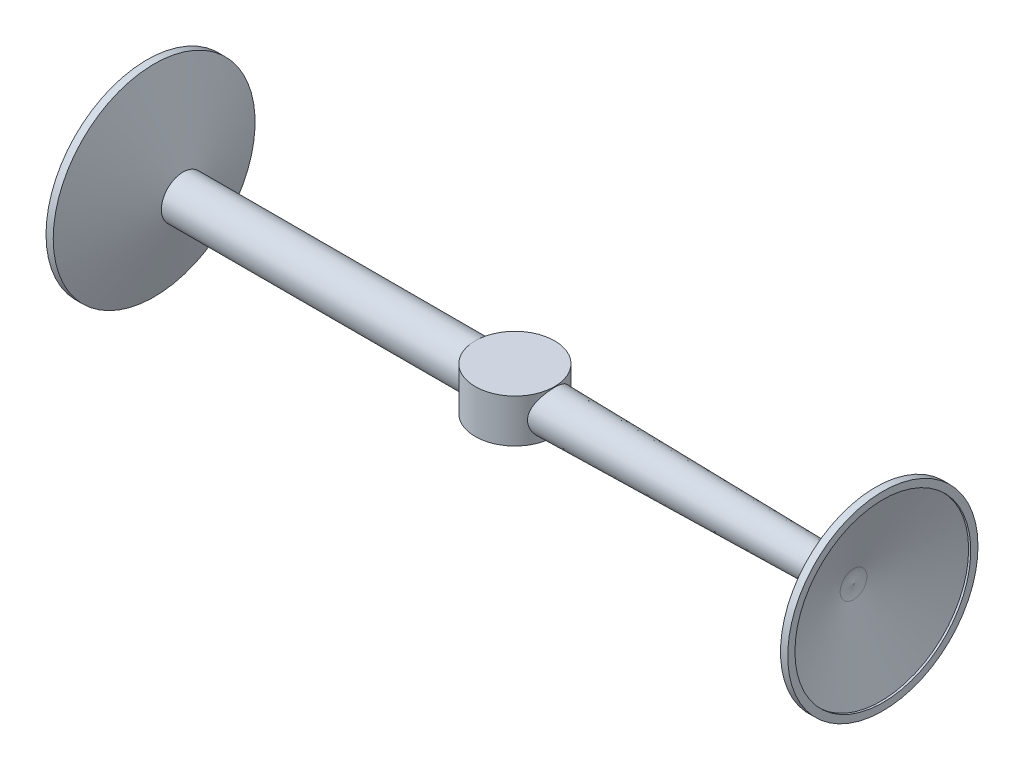
from build123d import *
from build123d.topology import SkipClean

# Parameters (mm, degrees)
SKETCH1_R                     = 27.5
BOSS_EXTRUDE1_DEPTH           = 30
SKETCH4_R                     = 15
BOSS_EXTRUDE3_DEPTH           = 230
BOSS_EXTRUDE3_TAPER           = 1
BOSS_EXTRUDE3_OTHER_WAY_DEPTH = 230
SKETCH2_R                     = 25
CUT_EXTRUDE4_DEPTH            = 20
SKETCH10_R                    = 65.934883456
BOSS_EXTRUDE7_DEPTH           = 5
SKETCH11_R                    = 69.949548389
BOSS_EXTRUDE8_DEPTH           = 5


# Read off the part's stored shape, not the designer's step: Boss-Extrude4, Boss-Extrude5
with BuildPart() as part:
    # Sketch1 → Boss-Extrude1 (new body)
    with BuildSketch(Plane(origin=(0, 0, 0), x_dir=(1, 0, 0), z_dir=(0, 1, 0))):
        with Locations(Location((0, 0, 0), (0, 0, 270))):
            Circle(SKETCH1_R)
    extrude(amount=BOSS_EXTRUDE1_DEPTH)

    # Sketch4 → Boss-Extrude3 (add)
    with BuildSketch(Plane(origin=(0, 0, 0), x_dir=(0, 0, -1), z_dir=(1, 0, 0))):
        with Locations((0, 15)):
            Circle(SKETCH4_R)
    extrude(amount=BOSS_EXTRUDE3_DEPTH, taper=BOSS_EXTRUDE3_TAPER)

    # Sketch4 → Boss-Extrude3 other way (add)
    with SkipClean():  # the faces are left unmerged after this step: merging them gives an invalid solid
        with BuildSketch(Plane(origin=(0, 0, 0), x_dir=(0, 0, -1), z_dir=(1, 0, 0))):
            with Locations((0, 15)):
                Circle(SKETCH4_R)
        extrude(amount=-BOSS_EXTRUDE3_OTHER_WAY_DEPTH)

    # Sketch2 → Cut-Extrude4 (cut)
    with SkipClean():  # the faces are left unmerged after this step: merging them gives an invalid solid
        with BuildSketch(Plane.XZ):
            with Locations(Location((0, 0, 0), (0, 0, 270))):
                Circle(SKETCH2_R)
        extrude(amount=-CUT_EXTRUDE4_DEPTH, mode=Mode.SUBTRACT)

    # Boss-Extrude4 outline → Boss-Extrude4 (revolve)
    with SkipClean():  # the faces are left unmerged after this step: merging them gives an invalid solid
        with BuildSketch(Plane(origin=(0, 15, 0), x_dir=(0, 1, 0), z_dir=(0, 0, -1))):
            Polygon((0, 230), (10.985335067, 230), (65.934883456, 250), (0, 250), align=None)
        revolve(axis=Axis((0, 15, 0), (1, 0, 0)))

    # Boss-Extrude5 outline → Boss-Extrude5 (revolve)
    with SkipClean():  # the faces are left unmerged after this step: merging them gives an invalid solid
        with BuildSketch(Plane(origin=(0, 15, 0), x_dir=(0, 1, 0), z_dir=(0, 0, -1))):
            Polygon((69.949548389, -250), (15, -230), (0, -230), (0, -250), align=None)
        revolve(axis=Axis((0, 15, 0), (1, 0, 0)))

    # Sketch10 → Boss-Extrude7 (add)
    with SkipClean():  # the faces are left unmerged after this step: merging them gives an invalid solid
        with BuildSketch(Plane(origin=(250, 0, 0), x_dir=(0, 0, -1), z_dir=(1, 0, 0))):
            with Locations((0, 15)):
                Circle(SKETCH10_R)
        extrude(amount=BOSS_EXTRUDE7_DEPTH)

    # Sketch11 → Boss-Extrude8 (add)
    with SkipClean():  # the faces are left unmerged after this step: merging them gives an invalid solid
        with BuildSketch(Plane.ZY.offset(250)):
            with Locations((0, 15)):
                Circle(SKETCH11_R)
        extrude(amount=BOSS_EXTRUDE8_DEPTH)

    # Sketch12 → Cut-Revolve3 (revolve, cut)
    with SkipClean():  # the faces are left unmerged after this step: merging them gives an invalid solid
        with BuildSketch(Plane(origin=(0, 15, 0), x_dir=(1, 0, 0), z_dir=(0, 1, 0)), mode=Mode.PRIVATE) as cut_revolve3_sk:
            with BuildLine():
                Line((-234.698463104, 13.289899283), (-253.501037691, 64.949548389))
                Line((-253.501037691, 64.949548389), (-255, 64.949548389))
                Line((-255, 64.949548389), (-255, 0))
                Line((-255, 0), (-234.698463104, 0))
                ThreePointArc((-234.698463104, 0), (-233.526779197, 6.644949642), (-234.698463104, 13.289899283))
            make_face()
        revolve(cut_revolve3_sk.sketch.rotate(Axis((373.268217057, 15, 0), (-1, 0, 0)), 270), axis=Axis((373.268217057, 15, 0), (-1, 0, 0)), mode=Mode.SUBTRACT)

    # Sketch14 → Cut-Revolve4 (revolve, cut)
    with SkipClean():  # the faces are left unmerged after this step: merging them gives an invalid solid
        with BuildSketch(Plane(origin=(0, 15, 0), x_dir=(1, 0, 0), z_dir=(0, 1, 0)), mode=Mode.PRIVATE) as cut_revolve4_sk:
            with BuildLine():
                Line((255, 60.934883456), (253.501037691, 60.934883456))
                Line((253.501037691, 60.934883456), (234.698463104, 9.27523435))
                ThreePointArc((234.698463104, 9.27523435), (233.88072607, 4.637617175), (234.698463104, 0))
                Line((234.698463104, 0), (255, 0))
                Line((255, 0), (255, 60.934883456))
            make_face()
        revolve(cut_revolve4_sk.sketch.rotate(Axis((84.599815478, 15, 0), (1, 0, 0)), 90), axis=Axis((84.599815478, 15, 0), (1, 0, 0)), mode=Mode.SUBTRACT)


solid = part.part
